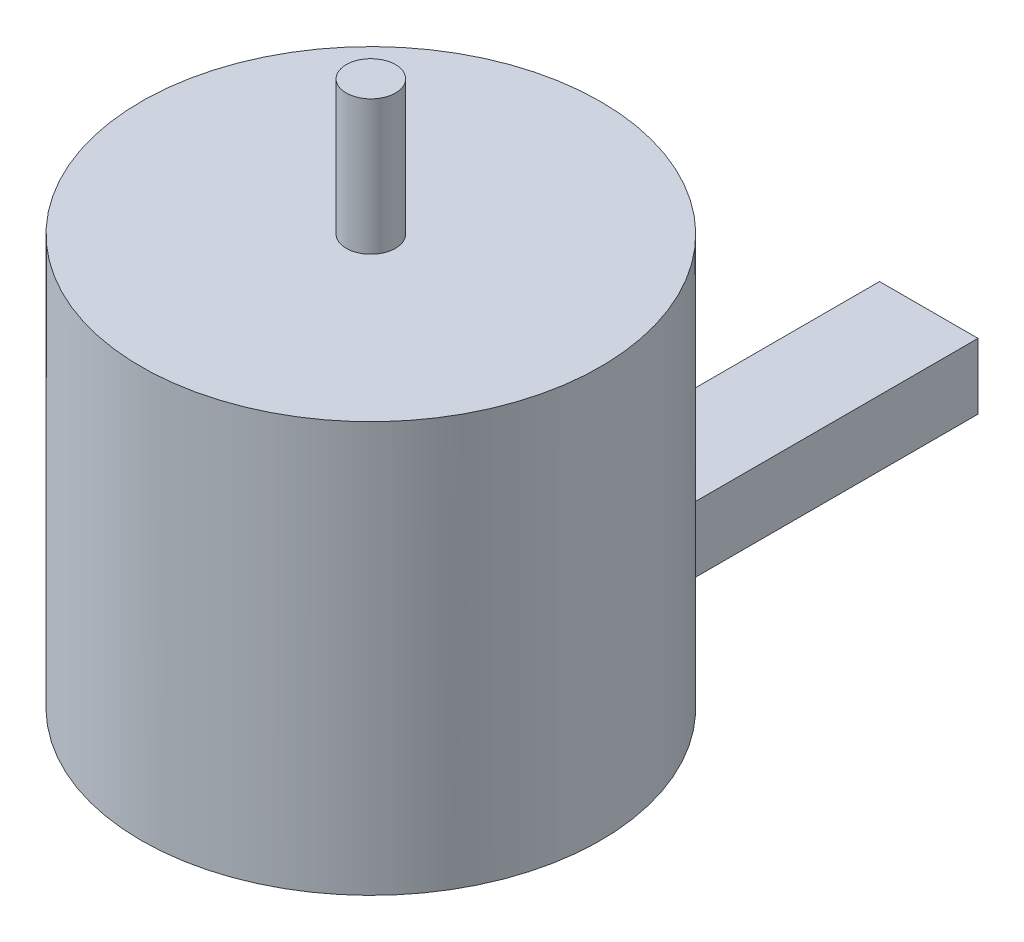
from build123d import *

# Parameters (mm, degrees)
M2X0_4_TAPPED_HOLE1_D     = 1.6
M2X0_4_TAPPED_HOLE1_DEPTH = 5.2
M2X0_4_TAPPED_HOLE1_TIP   = 0.480688495
BOSS_EXTRUDE1_DEPTH       = 10
BOSS_EXTRUDE1_DEPTH_BACK  = 2
SKETCH4_W                 = 3
SKETCH4_H                 = 2


with BuildPart() as part:
    # Sketch1 → Revolve1 (revolve)
    with BuildSketch(Plane.XY):
        Polygon((-0.75, 0), (-7, 0), (-7, 12.5), (-0.75, 12.5), (-0.75, 16.6), (0, 16.6), (0, -0.9), (-0.75, -0.9), align=None)
    revolve(axis=Axis((0, -74.460023863, 0), (0, 1, 0)))

    # M2x0.4 Tapped Hole1
    with Locations(Plane(origin=(0, 0, 0), x_dir=(-1, 0, 0), z_dir=(0, -1, 0))):
        with Locations((3.181980515, -3.181980515), (-3.181980515, -3.181980515), (-3.181980515, 3.181980515), (3.181980515, 3.181980515)):
            Hole(M2X0_4_TAPPED_HOLE1_D / 2, depth=M2X0_4_TAPPED_HOLE1_DEPTH)
            with Locations((0, 0, -(M2X0_4_TAPPED_HOLE1_DEPTH + M2X0_4_TAPPED_HOLE1_TIP / 2))):  # 118° drill point
                Cone(0, M2X0_4_TAPPED_HOLE1_D / 2, M2X0_4_TAPPED_HOLE1_TIP, mode=Mode.SUBTRACT)

    # Sketch4 → Boss-Extrude1 (add, two sides: drawn at the far end of the back side and taken through both)
    with BuildSketch(Plane(origin=(0, 0, -7), x_dir=(-1, 0, 0), z_dir=(0, 0, -1)).offset(-BOSS_EXTRUDE1_DEPTH_BACK)):
        with Locations((0, 1)):
            Rectangle(SKETCH4_W, SKETCH4_H)
    extrude(amount=BOSS_EXTRUDE1_DEPTH + BOSS_EXTRUDE1_DEPTH_BACK)


solid = part.part
